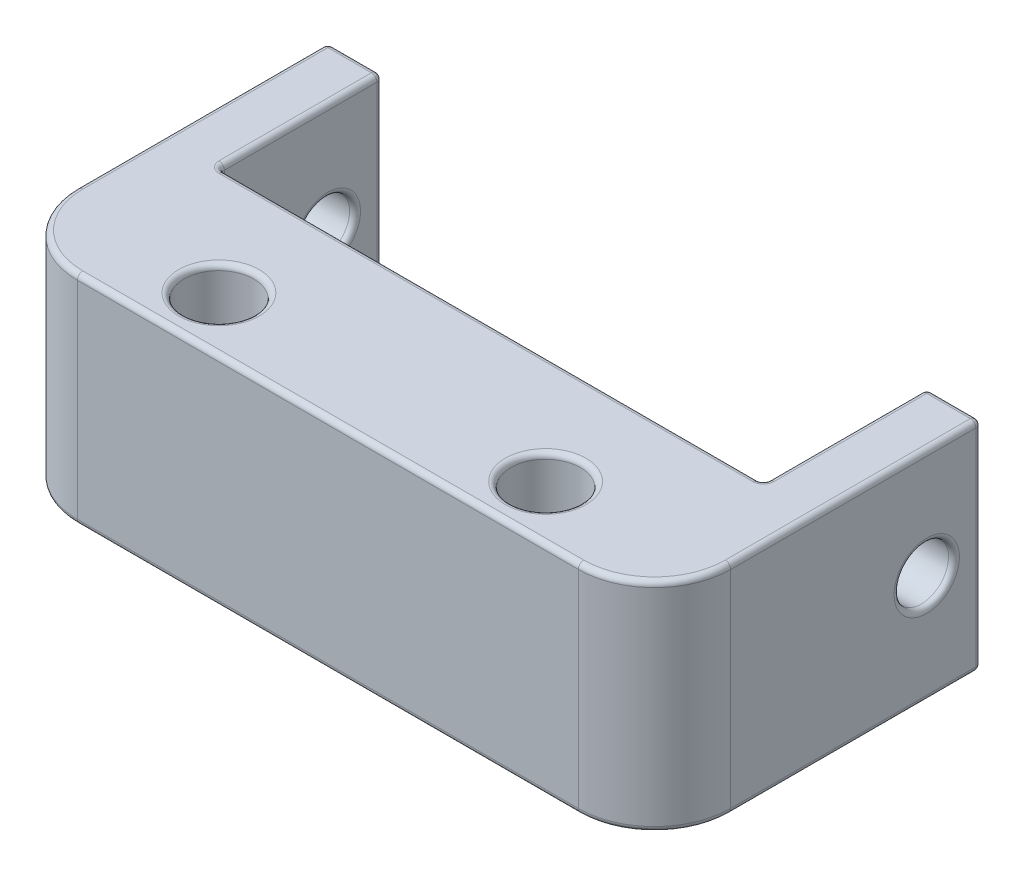
from build123d import *

# Parameters (mm, degrees)
SKETCH1_R           = 3.2
BOSS_EXTRUDE1_DEPTH = 20
SKETCH2_R           = 2.5
CUT_EXTRUDE1_DEPTH  = 70
FILLET1_R           = 0.5


with BuildPart() as part:
    # Sketch1 → Boss-Extrude1 (new body)
    with BuildSketch(Plane(origin=(0, 0, 0), x_dir=(1, 0, 0), z_dir=(0, 1, 0))):
        with BuildLine():
            Line((25, -5), (-25, -5))
            Line((-25, -5), (-25, 10))
            Line((-25, 10), (-30, 10))
            Line((-30, 10), (-30, -13))
            ThreePointArc((-30, -13), (-27.949747468, -17.949747468), (-23, -20))
            Line((-23, -20), (23, -20))
            ThreePointArc((23, -20), (27.949747468, -17.949747468), (30, -13))
            Line((30, -13), (30, 10))
            Line((30, 10), (25, 10))
            Line((25, 10), (25, -5))
        make_face()
        with Locations((15, -15)):
            Circle(SKETCH1_R, mode=Mode.SUBTRACT)
        with Locations((-15, -15)):
            Circle(SKETCH1_R, mode=Mode.SUBTRACT)
    extrude(amount=BOSS_EXTRUDE1_DEPTH)

    # Sketch2 → Cut-Extrude1 (cut)
    with BuildSketch(Plane.ZY.offset(30)):
        with Locations((-5, 10)):
            Circle(SKETCH2_R)
    extrude(amount=-CUT_EXTRUDE1_DEPTH, mode=Mode.SUBTRACT)

    # Fillet1
    fillet1_edges = [part.edges().sort_by_distance(p)[0] for p in [
        (25, 10, 5),
        (-18.2, 0, 15),
        (11.8, 0, 15),
        (-27.949747468, 0, 17.949747468),
        (0, 0, 20),
        (27.949747468, 0, 17.949747468),
        (25, 0, -2.5),
        (0, 0, 5),
        (30, 0, 1.5),
        (30, 10, -7.5),
        (-25, 10, 5),
        (-25, 0, -2.5),
        (-25, 10, -7.5),
        (-25, 10, -10),
        (-27.5, 0, -10),
        (-30, 10, -10),
        (-30, 0, 1.5),
        (-30, 10, -7.5),
        (30, 10, -10),
        (25, 10, -10),
        (27.5, 0, -10),
        (-18.2, 20, 15),
        (11.8, 20, 15),
        (25, 20, -2.5),
        (27.5, 20, -10),
        (30, 20, 1.5),
        (27.949747468, 20, 17.949747468),
        (0, 20, 20),
        (-27.949747468, 20, 17.949747468),
        (-30, 20, 1.5),
        (-27.5, 20, -10),
        (-25, 20, -2.5),
        (0, 20, 5),
        (25, 10, -7.5),
    ]]
    fillet(fillet1_edges, radius=FILLET1_R)


solid = part.part
